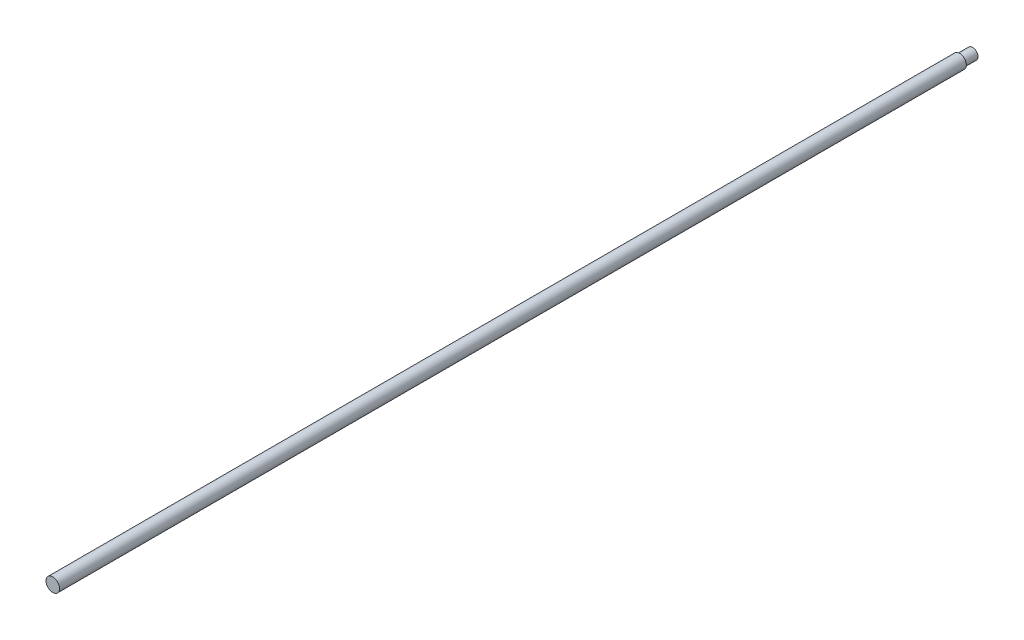
from build123d import *

# Parameters (mm, degrees)
ESQUISSE1_R                  = 2.5
BOSS_EXTRU_1_DEPTH           = 340
ESQUISSE2_OUTSIDE_W          = 75.014
ESQUISSE2_OUTSIDE_H          = 75.014
ESQUISSE2_OUTSIDE_R          = 2
ENL_V_MAT_EXTRU_1_DEPTH      = 4.8
TROU_TARAUD_M2_5X0_451_D     = 2.05
TROU_TARAUD_M2_5X0_451_DEPTH = 7.25
TROU_TARAUD_M2_5X0_451_TIP   = 0.615882135


with BuildPart() as part:
    # Esquisse1 → Boss.-Extru.1 (new body)
    with BuildSketch(Plane.XY):
        Circle(ESQUISSE1_R)
    extrude(amount=BOSS_EXTRU_1_DEPTH)

    # Esquisse2 outside → Enlèv. mat.-Extru.1 (cut)
    with BuildSketch(Plane(origin=(0, 0, 0), x_dir=(-1, 0, 0), z_dir=(0, 0, -1))):
        Rectangle(ESQUISSE2_OUTSIDE_W, ESQUISSE2_OUTSIDE_H)
        Circle(ESQUISSE2_OUTSIDE_R, mode=Mode.SUBTRACT)
    extrude(amount=-ENL_V_MAT_EXTRU_1_DEPTH, mode=Mode.SUBTRACT)

    # Trou taraudé M2.5x0.451
    with Locations(Plane(origin=(0, 0, 0), x_dir=(-1, 0, 0), z_dir=(0, 0, -1))):
        with Locations((0, 0)):
            Hole(TROU_TARAUD_M2_5X0_451_D / 2, depth=TROU_TARAUD_M2_5X0_451_DEPTH)
            with Locations((0, 0, -(TROU_TARAUD_M2_5X0_451_DEPTH + TROU_TARAUD_M2_5X0_451_TIP / 2))):  # 118° drill point
                Cone(0, TROU_TARAUD_M2_5X0_451_D / 2, TROU_TARAUD_M2_5X0_451_TIP, mode=Mode.SUBTRACT)


solid = part.part
